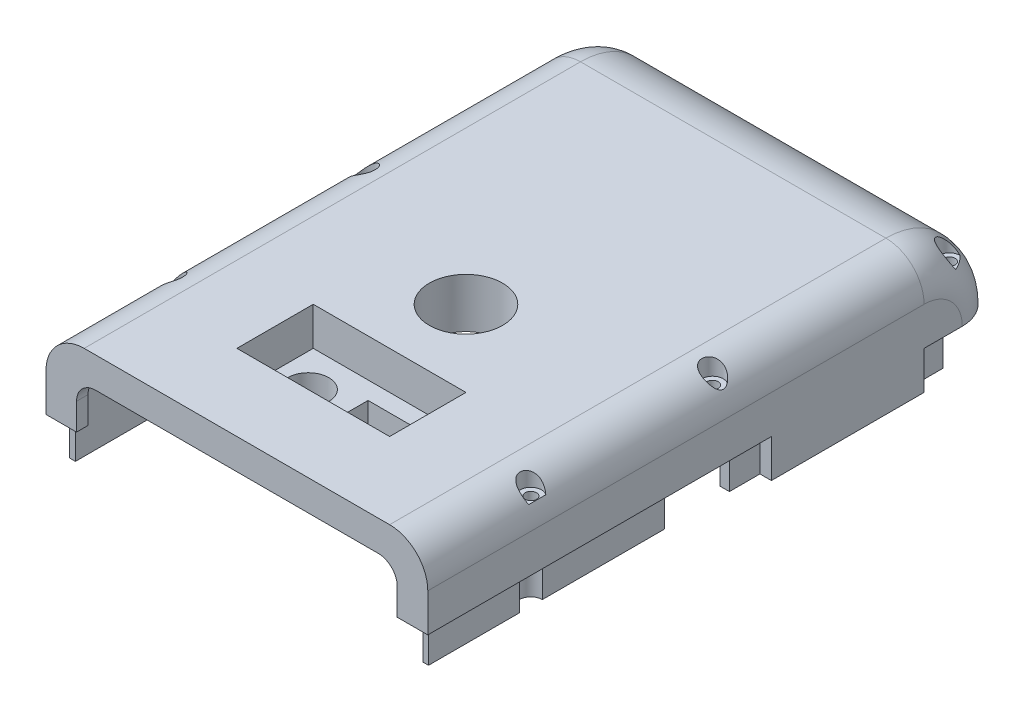
from build123d import *

# Parameters (mm, degrees)
SKETCH_1_W                  = 100
SKETCH_1_H                  = 150
EXTRUDE_1_DEPTH             = 20
FILLET_1_R                  = 10
FILLET_2_R                  = 20
SKETCH_4_W                  = 40
SKETCH_4_H                  = 20
CUT_EXTRUDE_4_DEPTH         = 10
SHELL_START                 = -55
SHELL_6_DEPTH               = 127
SHELL_6_2_OUTLINE_W         = 46
SHELL_6_2_OUTLINE_H         = 10
SHELL_6_2_DEPTH             = 87
SHELL_START_2               = 58
SHELL_6_3_OUTLINE_W         = 46
SHELL_6_3_OUTLINE_H         = 10
SHELL_6_3_DEPTH             = 14
SKETCH_5_W                  = 3
SKETCH_5_H                  = 40
EXTRUDE_2_DEPTH             = 10
SKETCH_6_W                  = 2.5
SKETCH_6_H                  = 56
EXTRUDE_3_DEPTH             = 10
EXTRUDE_3_DIRECTION_2_REACH = 94.331
SKETCH_7_W                  = 75.1
SKETCH_7_H                  = 0.933831371
EXTRUDE_4_DEPTH             = 10
EXTRUDE_4_DIRECTION_2_REACH = 94.331
EXTRUDE_5_REACH             = 94.331
SKETCH_9_R                  = 3
EXTRUDE_6_REACH             = 94.331
SKETCH_11_R                 = 1.5
SKETCH_11_R_2               = 1.485350611
CUT_EXTRUDE_1_DEPTH         = 93.330926563
CUT_EXTRUDE_3_DEPTH         = 10
SKETCH_14_R                 = 5.4
CUT_EXTRUDE_5_DEPTH         = 93.33092672
SKETCH_15_R                 = 5.4
EXTRUDE_7_DEPTH             = 10
CUT_EXTRUDE_6_REACH         = 145.489
CUT_EXTRUDE_6_END_RADIUS    = 5.4
SKETCH_16_R                 = 1.486157395
CUT_EXTRUDE_7_REACH         = 94.331
SKETCH_17_W                 = 18
SKETCH_17_H                 = 10
SKETCH_18_W                 = 18
SKETCH_18_H                 = 10
EXTRUDE_8_DEPTH             = 10
CUT_EXTRUDE_8_REACH         = 145.489
SKETCH_19_R                 = 1.5
FILLET_3_R                  = 1
CUT_EXTRUDE_9_REACH         = 97
SKETCH_20_R                 = 9.6
SKETCH_21_R                 = 12.6
SKETCH_21_R_2               = 9.6
EXTRUDE_9_DEPTH             = 10
SKETCH_27_R                 = 2.8
CUT_EXTRUDE_12_DEPTH        = 5
SKETCH_28_R                 = 2.8
CUT_EXTRUDE_13_DEPTH        = 8


with BuildPart() as part:
    # 草图1 → 凸台-拉伸1 (new body)
    with BuildSketch(Plane(origin=(0, 0, 0), x_dir=(1, 0, 0), z_dir=(0, 1, 0))):
        Rectangle(SKETCH_1_W, SKETCH_1_H)
    extrude(amount=EXTRUDE_1_DEPTH)

    # 圆角1
    fillet_1_edges = [part.edges().sort_by_distance(p)[0] for p in [
        (50, 20, 0),
        (-50, 20, 0),
        (-50, 10, -75),
        (50, 10, -75),
    ]]
    fillet(fillet_1_edges, radius=FILLET_1_R)

    # 圆角2
    # the kernel refuses this fillet: 20 mm, written as the material it takes off along each edge
    with BuildSketch(Plane(origin=(-50, 0, -55), x_dir=(0, 1, 0), z_dir=(0, 0, 1))) as fillet_2_piece_1:
        with BuildLine():
            CenterArc((10, -10), 10, 0, 90)
            Line((20, -10), (20, 0))
            Line((20, 0), (10, 0))
        make_face()
    revolve(axis=Axis((-50, 0, -55), (-1, 0, 0)), revolution_arc=90, mode=Mode.SUBTRACT)
    with BuildSketch(Plane(origin=(50, 0, -55), x_dir=(0, 0, -1), z_dir=(0, -1, 0))) as fillet_2_piece_2:
        with BuildLine():
            CenterArc((10, -10), 10, 0, 90)
            Line((20, -10), (20, 0))
            Line((20, 0), (10, 0))
        make_face()
    revolve(axis=Axis((50, 0, -55), (1, 0, 0)), revolution_arc=90, mode=Mode.SUBTRACT)
    with BuildSketch(Plane(origin=(50, 20, -75), x_dir=(0, -1, 0), z_dir=(-1, 0, 0))) as fillet_2_piece_3:
        with BuildLine():
            CenterArc((FILLET_2_R, FILLET_2_R), FILLET_2_R, 180, 90)
            Line((0, FILLET_2_R), (0, 0))
            Line((0, 0), (FILLET_2_R, 0))
        make_face()
    extrude(amount=100, mode=Mode.SUBTRACT)

    # 草图4 → 切除-拉伸4 (cut)
    with BuildSketch(Plane(origin=(0, 20, 0), x_dir=(1, 0, 0), z_dir=(0, 1, 0))):
        with Locations((0, -45)):
            Rectangle(SKETCH_4_W, SKETCH_4_H)
    extrude(amount=-CUT_EXTRUDE_4_DEPTH, mode=Mode.SUBTRACT)

    # 抽壳6: read off the stored shape, not the designer's step
    # 抽壳6 outline → 抽壳6 (cut)
    with BuildSketch(Plane.XY.offset(SHELL_START)):
        with BuildLine():
            Line((47, 0), (47, 10))
            ThreePointArc((47, 10), (44.949747468, 14.949747468), (40, 17))
            Line((40, 17), (23, 17))
            Line((23, 17), (23, 7))
            Line((23, 7), (-23, 7))
            Line((-23, 7), (-23, 17))
            Line((-23, 17), (-40, 17))
            ThreePointArc((-40, 17), (-44.949747468, 14.949747468), (-47, 10))
            Line((-47, 10), (-47, 0))
            Line((-47, 0), (47, 0))
        make_face()
    extrude(amount=SHELL_6_DEPTH, mode=Mode.SUBTRACT)

    # Shell 6 2 outline → Shell 6 2 (cut)
    with BuildSketch(Plane.XY.offset(SHELL_START)):
        with Locations((0, 12)):
            Rectangle(SHELL_6_2_OUTLINE_W, SHELL_6_2_OUTLINE_H)
    extrude(amount=SHELL_6_2_DEPTH, mode=Mode.SUBTRACT)

    # Shell 6 3 outline → Shell 6 3 (cut)
    with BuildSketch(Plane.XY.offset(SHELL_START_2)):
        with Locations((0, 12)):
            Rectangle(SHELL_6_3_OUTLINE_W, SHELL_6_3_OUTLINE_H)
    extrude(amount=SHELL_6_3_DEPTH, mode=Mode.SUBTRACT)

    # Shell 6 4 outline → Shell 6 4 (revolve, cut)
    with BuildSketch(Plane.YX.offset(55)):
        with BuildLine():
            Line((0, -47), (10, -47))
            ThreePointArc((10, -47), (14.949747468, -44.949747468), (17, -40))
            Line((17, -40), (17, 40))
            ThreePointArc((17, 40), (14.949747468, 44.949747468), (10, 47))
            Line((10, 47), (0, 47))
            Line((0, 47), (0, -47))
        make_face()
    revolve(axis=Axis((0, 0, -55), (1, 0, 0)), mode=Mode.SUBTRACT)

    # 草图5 → 凸台-拉伸2 (add)
    with BuildSketch(Plane.XZ):
        with Locations((48.5, -35)):
            Rectangle(SKETCH_5_W, SKETCH_5_H)
        with Locations((-48.5, -35)):
            Rectangle(SKETCH_5_W, SKETCH_5_H)
    extrude(amount=EXTRUDE_2_DEPTH)

    # 草图6 → 凸台-拉伸3 (add)
    with BuildSketch(Plane.XZ):
        with Locations((45.75, -35)):
            Rectangle(SKETCH_6_W, SKETCH_6_H)
        with Locations((-45.75, -35)):
            Rectangle(SKETCH_6_W, SKETCH_6_H)
    extrude(amount=EXTRUDE_3_DEPTH)

    # 草图6 → 凸台-拉伸3 direction 2 (add, up to next)
    with BuildSketch(Plane.XZ, mode=Mode.PRIVATE) as extrude_3_direction_2_sk1:
        with Locations((45.75, -35)):
            Rectangle(SKETCH_6_W, SKETCH_6_H)
    extrude_3_direction_2_tool1 = extrude(extrude_3_direction_2_sk1.sketch, amount=-EXTRUDE_3_DIRECTION_2_REACH, mode=Mode.PRIVATE) - part.part
    # 草图6 → 凸台-拉伸3 direction 2 (add, up to next)
    with BuildSketch(Plane.XZ, mode=Mode.PRIVATE) as extrude_3_direction_2_sk2:
        with Locations((-45.75, -35)):
            Rectangle(SKETCH_6_W, SKETCH_6_H)
    extrude_3_direction_2_tool2 = extrude(extrude_3_direction_2_sk2.sketch, amount=-EXTRUDE_3_DIRECTION_2_REACH, mode=Mode.PRIVATE) - part.part
    add(extrude_3_direction_2_tool1.solids().sort_by_distance((45.75, 0, -35))[0])
    add(extrude_3_direction_2_tool2.solids().sort_by_distance((-45.75, 0, -35))[0])

    # 草图7 → 凸台-拉伸4 (add)
    with BuildSketch(Plane.XZ):
        with BuildLine():
            Line((-47, 71.8), (-47, 48))
            ThreePointArc((-47, 48), (-44, 45), (-47, 42))
            Line((-47, 42), (-47, 10))
            Line((-47, 10), (-45.5, 10))
            Line((-45.5, 10), (-45.5, 40.757359313))
            ThreePointArc((-45.5, 40.757359313), (-42.5, 45), (-45.5, 49.242640687))
            Line((-45.5, 49.242640687), (-45.5, 71.8))
            Line((-45.5, 71.8), (-47, 71.8))
        make_face()
        with BuildLine():
            Line((47, 71.8), (45.5, 71.8))
            Line((45.5, 71.8), (45.5, 49.242640687))
            ThreePointArc((45.5, 49.242640687), (42.5, 45), (45.5, 40.757359313))
            Line((45.5, 40.757359313), (45.5, 10))
            Line((45.5, 10), (47, 10))
            Line((47, 10), (47, 42))
            ThreePointArc((47, 42), (44, 45), (47, 48))
            Line((47, 48), (47, 71.8))
        make_face()
        with Locations((-0.25, -71.533084315)):
            Rectangle(SKETCH_7_W, SKETCH_7_H)
    extrude(amount=EXTRUDE_4_DEPTH)

    # 草图7 → 凸台-拉伸4 direction 2 (add, up to next)
    with BuildSketch(Plane.XZ, mode=Mode.PRIVATE) as extrude_4_direction_2_sk1:
        with BuildLine():
            Line((-47, 71.8), (-47, 48))
            ThreePointArc((-47, 48), (-44, 45), (-47, 42))
            Line((-47, 42), (-47, 10))
            Line((-47, 10), (-45.5, 10))
            Line((-45.5, 10), (-45.5, 40.757359313))
            ThreePointArc((-45.5, 40.757359313), (-42.5, 45), (-45.5, 49.242640687))
            Line((-45.5, 49.242640687), (-45.5, 71.8))
            Line((-45.5, 71.8), (-47, 71.8))
        make_face()
    extrude_4_direction_2_tool1 = extrude(extrude_4_direction_2_sk1.sketch, amount=-EXTRUDE_4_DIRECTION_2_REACH, mode=Mode.PRIVATE) - part.part
    # 草图7 → 凸台-拉伸4 direction 2 (add, up to next)
    with BuildSketch(Plane.XZ, mode=Mode.PRIVATE) as extrude_4_direction_2_sk2:
        with BuildLine():
            Line((47, 71.8), (45.5, 71.8))
            Line((45.5, 71.8), (45.5, 49.242640687))
            ThreePointArc((45.5, 49.242640687), (42.5, 45), (45.5, 40.757359313))
            Line((45.5, 40.757359313), (45.5, 10))
            Line((45.5, 10), (47, 10))
            Line((47, 10), (47, 42))
            ThreePointArc((47, 42), (44, 45), (47, 48))
            Line((47, 48), (47, 71.8))
        make_face()
    extrude_4_direction_2_tool2 = extrude(extrude_4_direction_2_sk2.sketch, amount=-EXTRUDE_4_DIRECTION_2_REACH, mode=Mode.PRIVATE) - part.part
    # 草图7 → 凸台-拉伸4 direction 2 (add, up to next)
    with BuildSketch(Plane.XZ, mode=Mode.PRIVATE) as extrude_4_direction_2_sk3:
        with Locations((-0.25, -71.533084315)):
            Rectangle(SKETCH_7_W, SKETCH_7_H)
    extrude_4_direction_2_tool3 = extrude(extrude_4_direction_2_sk3.sketch, amount=-EXTRUDE_4_DIRECTION_2_REACH, mode=Mode.PRIVATE) - part.part
    add(extrude_4_direction_2_tool1.solids().sort_by_distance((-45.945319, 0, 41.086828))[0])
    add(extrude_4_direction_2_tool2.solids().sort_by_distance((45.945319, 0, 41.086828))[0])
    add(extrude_4_direction_2_tool3.solids().sort_by_distance((-0.25, 0, -71.533084))[0])

    # 草图9 → 凸台-拉伸5 (add, up to next)
    with BuildSketch(Plane(origin=(0, 0, 0), x_dir=(-1, 0, 0), z_dir=(0, -1, 0)), mode=Mode.PRIVATE) as extrude_5_sk1:
        with Locations((-47, -45)):
            Circle(SKETCH_9_R)
    extrude_5_tool1 = extrude(extrude_5_sk1.sketch, amount=-EXTRUDE_5_REACH, mode=Mode.PRIVATE) - part.part
    # 草图9 → 凸台-拉伸5 (add, up to next)
    with BuildSketch(Plane(origin=(0, 0, 0), x_dir=(-1, 0, 0), z_dir=(0, -1, 0)), mode=Mode.PRIVATE) as extrude_5_sk2:
        with Locations((47, -45)):
            Circle(SKETCH_9_R)
    extrude_5_tool2 = extrude(extrude_5_sk2.sketch, amount=-EXTRUDE_5_REACH, mode=Mode.PRIVATE) - part.part
    # 草图9 → 凸台-拉伸5 (add, up to next)
    with BuildSketch(Plane(origin=(0, 0, 0), x_dir=(-1, 0, 0), z_dir=(0, -1, 0)), mode=Mode.PRIVATE) as extrude_5_sk3:
        with BuildLine():
            Line((-47, -3), (-47, 7))
            Line((-47, 7), (-44.5, 7))
            Line((-44.5, 7), (-44.5, 15))
            Line((-44.5, 15), (-42.8, 15))
            ThreePointArc((-42.8, 15), (-41.385786438, 14.414213562), (-40.8, 13))
            Line((-40.8, 13), (-40.8, 1))
            ThreePointArc((-40.8, 1), (-41.385786438, -0.414213562), (-42.8, -1))
            Line((-42.8, -1), (-45, -1))
            ThreePointArc((-45, -1), (-46.414213562, -1.585786438), (-47, -3))
        make_face()
    extrude_5_tool3 = extrude(extrude_5_sk3.sketch, amount=-EXTRUDE_5_REACH, mode=Mode.PRIVATE) - part.part
    # 草图9 → 凸台-拉伸5 (add, up to next)
    with BuildSketch(Plane(origin=(0, 0, 0), x_dir=(-1, 0, 0), z_dir=(0, -1, 0)), mode=Mode.PRIVATE) as extrude_5_sk4:
        with BuildLine():
            Line((42.8, -1), (45, -1))
            ThreePointArc((45, -1), (46.414213562, -1.585786438), (47, -3))
            Line((47, -3), (47, 7))
            Line((47, 7), (44.5, 7))
            Line((44.5, 7), (44.5, 15))
            Line((44.5, 15), (42.8, 15))
            ThreePointArc((42.8, 15), (41.385786438, 14.414213562), (40.8, 13))
            Line((40.8, 13), (40.8, 1))
            ThreePointArc((40.8, 1), (41.385786438, -0.414213562), (42.8, -1))
        make_face()
    extrude_5_tool4 = extrude(extrude_5_sk4.sketch, amount=-EXTRUDE_5_REACH, mode=Mode.PRIVATE) - part.part
    add(extrude_5_tool1.solids().sort_by_distance((47, 0, 45))[0])
    add(extrude_5_tool2.solids().sort_by_distance((-47, 0, 45))[0])
    add(extrude_5_tool3.solids().sort_by_distance((43.514927, 0, -5.886278))[0])
    add(extrude_5_tool4.solids().sort_by_distance((-43.514927, 0, -5.886278))[0])

    # 草图10 → 凸台-拉伸6 (add, up to next)
    with BuildSketch(Plane.XZ, mode=Mode.PRIVATE) as extrude_6_sk1:
        with BuildLine():
            Line((-40, -72), (-40, -57))
            ThreePointArc((-40, -57), (-40.585786438, -55.585786438), (-42, -55))
            Line((-42, -55), (-44.5, -55))
            Line((-44.5, -55), (-44.5, -63))
            Line((-44.5, -63), (-47, -63))
            Line((-47, -63), (-47, -65))
            ThreePointArc((-47, -65), (-44.949747468, -69.949747468), (-40, -72))
        make_face()
    extrude_6_tool1 = extrude(extrude_6_sk1.sketch, amount=-EXTRUDE_6_REACH, mode=Mode.PRIVATE) - part.part
    # 草图10 → 凸台-拉伸6 (add, up to next)
    with BuildSketch(Plane.XZ, mode=Mode.PRIVATE) as extrude_6_sk2:
        with BuildLine():
            Line((47, -63), (47, -65))
            ThreePointArc((47, -65), (44.949747468, -69.949747468), (40, -72))
            Line((40, -72), (40, -57))
            ThreePointArc((40, -57), (40.585786438, -55.585786438), (42, -55))
            Line((42, -55), (44.5, -55))
            Line((44.5, -55), (44.5, -63))
            Line((44.5, -63), (47, -63))
        make_face()
    extrude_6_tool2 = extrude(extrude_6_sk2.sketch, amount=-EXTRUDE_6_REACH, mode=Mode.PRIVATE) - part.part
    add(extrude_6_tool1.solids().sort_by_distance((-42.783986, 0, -63.773584))[0])
    add(extrude_6_tool2.solids().sort_by_distance((42.783986, 0, -63.773584))[0])

    # 草图11 → 切除-拉伸1 (cut, through all)
    with BuildSketch(Plane.XZ):
        with Locations(Location((-45.65, -66, 0), (0, 0, 270))):
            Circle(SKETCH_11_R)
        with Locations(Location((-45.605138498, -4, 0), (0, 0, 270))):
            Circle(SKETCH_11_R)
        with Locations(Location((-47, 45, 0), (0, 0, 270))):
            Circle(SKETCH_11_R_2)
        with Locations(Location((47, 45, 0), (0, 0, 270))):
            Circle(SKETCH_11_R)
        with Locations(Location((45.605138498, -4, 0), (0, 0, 270))):
            Circle(SKETCH_11_R)
        with Locations(Location((45.65, -66, 0), (0, 0, 270))):
            Circle(SKETCH_11_R)
    extrude(amount=-CUT_EXTRUDE_1_DEPTH, mode=Mode.SUBTRACT)

    # 草图13 → 切除-拉伸3 (cut)
    with BuildSketch(Plane.XY.offset(75)):
        with BuildLine():
            Line((-42, 0), (42, 0))
            Line((42, 0), (42, 7))
            ThreePointArc((42, 7), (40.535533906, 10.535533906), (37, 12))
            Line((37, 12), (-37, 12))
            ThreePointArc((-37, 12), (-40.535533906, 10.535533906), (-42, 7))
            Line((-42, 7), (-42, 0))
        make_face()
    extrude(amount=-CUT_EXTRUDE_3_DEPTH, mode=Mode.SUBTRACT)

    # 草图14 → 切除-拉伸5 (cut, through all)
    with BuildSketch(Plane(origin=(0, 10, 0), x_dir=(1, 0, 0), z_dir=(0, 1, 0))):
        with Locations(Location((-11.312679302, -45, 0), (0, 0, 270))):
            Circle(SKETCH_14_R)
    extrude(amount=-CUT_EXTRUDE_5_DEPTH, mode=Mode.SUBTRACT)

    # 草图15 → 凸台-拉伸7 (add)
    with BuildSketch(Plane.XZ.offset(-7)):
        with BuildLine():
            Line((-14.312679302, 52.846018098), (-14.312679302, 58))
            Line((-14.312679302, 58), (-8.312679302, 58))
            Line((-8.312679302, 58), (-8.312679302, 52.846018098))
            ThreePointArc((-8.312679302, 52.846018098), (-11.312679302, 36.6), (-14.312679302, 52.846018098))
        make_face()
        with Locations(Location((-11.312679302, 45, 0), (0, 0, 90))):
            Circle(SKETCH_15_R, mode=Mode.SUBTRACT)
    extrude(amount=EXTRUDE_7_DEPTH)

    # 切除-拉伸6: up to this cylinder (the profile starts outside it)
    cut_extrude_6_end = Plane(origin=(-11.312679302, 2, 45), z_dir=(0, 1, 0)) * Cylinder(CUT_EXTRUDE_6_END_RADIUS, 302.778, mode=Mode.PRIVATE)
    # 草图16 → 切除-拉伸6 (cut, up to the surface)
    with BuildSketch(Plane.XY.offset(58), mode=Mode.PRIVATE) as cut_extrude_6_sk1:
        with Locations((-11.312679302, 2)):
            Circle(SKETCH_16_R)
    cut_extrude_6_tool1 = extrude(cut_extrude_6_sk1.sketch, amount=-CUT_EXTRUDE_6_REACH, mode=Mode.PRIVATE) - cut_extrude_6_end
    add(cut_extrude_6_tool1.solids().sort_by_distance((-11.312679, 2, 58))[0], mode=Mode.SUBTRACT)

    # 草图17 → 切除-拉伸7 (cut, up to next)
    with BuildSketch(Plane(origin=(0, 10, 0), x_dir=(1, 0, 0), z_dir=(0, 1, 0)), mode=Mode.PRIVATE) as cut_extrude_7_sk1:
        with Locations((8, -44.639036653)):
            Rectangle(SKETCH_17_W, SKETCH_17_H)
    cut_extrude_7_tool1 = extrude(cut_extrude_7_sk1.sketch, amount=-CUT_EXTRUDE_7_REACH, mode=Mode.PRIVATE) & part.part
    add(cut_extrude_7_tool1.solids().sort_by_distance((8, 10, 44.639037))[0], mode=Mode.SUBTRACT)

    # 草图18 → 凸台-拉伸8 (add)
    with BuildSketch(Plane.XZ.offset(-7)):
        Polygon((-4, 52.639036653), (-4, 36.639036653), (20, 36.639036653), (20, 52.639036653), (11, 52.639036653), (11, 58), (5, 58), (5, 52.639036653), align=None)
        with Locations((8, 44.639036653)):
            Rectangle(SKETCH_18_W, SKETCH_18_H, mode=Mode.SUBTRACT)
    extrude(amount=EXTRUDE_8_DEPTH)

    # 草图19 → 切除-拉伸8 (cut, up to next)
    with BuildSketch(Plane.XY.offset(58), mode=Mode.PRIVATE) as cut_extrude_8_sk1:
        with Locations((8, 2)):
            Circle(SKETCH_19_R)
    cut_extrude_8_tool1 = extrude(cut_extrude_8_sk1.sketch, amount=-CUT_EXTRUDE_8_REACH, mode=Mode.PRIVATE) & part.part
    add(cut_extrude_8_tool1.solids().sort_by_distance((8, 2, 58))[0], mode=Mode.SUBTRACT)

    # 圆角3
    fillet_3_edges = [part.edges().sort_by_distance(p)[0] for p in [
        (-17.678699767, -3, 39.519691301),
        (-8.312679302, -3, 55.423009049),
        (-14.312679302, -3, 55.423009049),
        (-17.678699767, 7, 39.519691301),
        (-14.312679302, 2, 52.846018098),
        (-4, 2, 40.866633161),
        (-4, 7, 38.752834907),
        (-4, 7, 50.886201746),
        (-4, 2, 52.639036653),
        (-4, -3, 38.752834907),
        (8, -3, 36.639036653),
        (15.5, -3, 52.639036653),
        (11, -3, 55.319518327),
        (5, -3, 55.319518327),
        (0.5, -3, 52.639036653),
        (0.5, 7, 52.639036653),
        (5, 2, 52.639036653),
        (8, 7, 36.639036653),
        (-4, 2, 36.639036653),
        (20, 7, 44.639036653),
        (20, 2, 36.639036653),
        (15.5, 7, 52.639036653),
        (20, 2, 52.639036653),
        (11, 2, 52.639036653),
    ]]
    fillet(fillet_3_edges, radius=FILLET_3_R)

    # 草图20 → 切除-拉伸9 (cut, up to next)
    with BuildSketch(Plane(origin=(0, 20, 0), x_dir=(1, 0, 0), z_dir=(0, 1, 0)), mode=Mode.PRIVATE) as cut_extrude_9_sk1:
        with Locations(Location((0, -15, 0), (0, 0, 270))):
            Circle(SKETCH_20_R)
    cut_extrude_9_tool1 = extrude(cut_extrude_9_sk1.sketch, amount=-CUT_EXTRUDE_9_REACH, mode=Mode.PRIVATE) & part.part
    add(cut_extrude_9_tool1.solids().sort_by_distance((0, 20, 15))[0], mode=Mode.SUBTRACT)

    # 草图21 → 凸台-拉伸9 (add)
    with BuildSketch(Plane(origin=(0, 17, 0), x_dir=(-1, 0, 0), z_dir=(0, -1, 0))):
        with Locations(Location((0, -15, 0), (0, 0, 90))):
            Circle(SKETCH_21_R)
        with Locations(Location((0, -15, 0), (0, 0, 270))):
            Circle(SKETCH_21_R_2, mode=Mode.SUBTRACT)
    extrude(amount=EXTRUDE_9_DEPTH)

    # 草图27 → 切除-拉伸12 (cut)
    with BuildSketch(Plane(origin=(0, 20, 0), x_dir=(1, 0, 0), z_dir=(0, 1, 0))):
        with Locations(Location((45.605138498, 4, 0), (0, 0, 270))):
            Circle(SKETCH_27_R)
        with Locations((47, -45)):
            Circle(SKETCH_27_R)
        with Locations((-47, -45)):
            Circle(SKETCH_27_R)
        with Locations(Location((-45.605138498, 4, 0), (0, 0, 270))):
            Circle(SKETCH_27_R)
    extrude(amount=-CUT_EXTRUDE_12_DEPTH, mode=Mode.SUBTRACT)

    # 草图28 → 切除-拉伸13 (cut)
    with BuildSketch(Plane(origin=(0, 20, 0), x_dir=(1, 0, 0), z_dir=(0, 1, 0))):
        with Locations((-45.65, 66)):
            Circle(SKETCH_28_R)
        with Locations((45.65, 66)):
            Circle(SKETCH_28_R)
    extrude(amount=-CUT_EXTRUDE_13_DEPTH, mode=Mode.SUBTRACT)


solid = part.part
